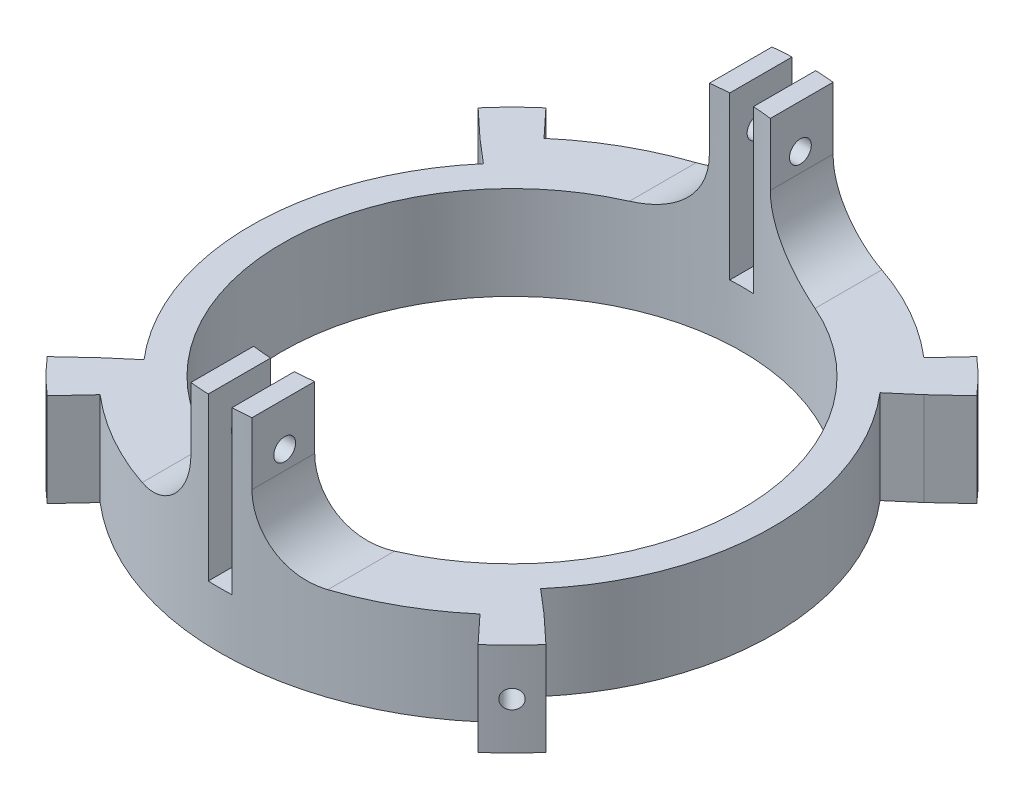
from build123d import *
from build123d.topology import SkipClean

# Parameters (mm, degrees)
SKETCH1_R           = 46.9
SKETCH1_R_2         = 36.9
BOSS_EXTRUDE1_DEPTH = 15
BOSS_EXTRUDE2_DEPTH = 20
SKETCH4_W           = 3.8
SKETCH4_H           = 13.672543204
CUT_EXTRUDE2_DEPTH  = 6
SKETCH5_R           = 1.75
CUT_EXTRUDE3_DEPTH  = 75.99479982
FILLET3_R           = 10
BOSS_EXTRUDE3_DEPTH = 15
SKETCH9_R           = 1.5
CUT_EXTRUDE4_DEPTH  = 15
CIRPATTERN1_COUNT   = 4
CUT_EXTRUDE5_DEPTH  = 15


with BuildPart() as part:
    # Sketch1 → Boss-Extrude1 (new body)
    with BuildSketch(Plane(origin=(0, 0, 0), x_dir=(1, 0, 0), z_dir=(0, 1, 0))):
        with Locations(Location((0, 0, 0), (0, 0, 270))):
            Circle(SKETCH1_R)
        with Locations(Location((0, 0, 0), (0, 0, 270))):
            Circle(SKETCH1_R_2, mode=Mode.SUBTRACT)
    extrude(amount=BOSS_EXTRUDE1_DEPTH)

    # Sketch7 → Boss-Extrude2 (add)
    with SkipClean():  # the faces are left unmerged after this step: merging them gives an invalid solid
        with BuildSketch(Plane(origin=(0, 15, 0), x_dir=(1, 0, 0), z_dir=(0, 1, 0))):
            with BuildLine():
                Line((-1.9, 46.861498055), (-1.9, 36.851051545))
                ThreePointArc((-1.9, 36.851051545), (-3.402836815, 36.742763935), (-4.9, 36.573214242))
                Line((-4.9, 36.573214242), (-4.9, 46.643327497))
                ThreePointArc((-4.9, 46.643327497), (-3.401749491, 46.776469516), (-1.9, 46.861498055))
            make_face()
            with BuildLine():
                Line((4.9, 46.643327497), (4.9, 36.573214242))
                ThreePointArc((4.9, 36.573214242), (3.402836815, 36.742763935), (1.9, 36.851051545))
                Line((1.9, 36.851051545), (1.9, 46.861498055))
                ThreePointArc((1.9, 46.861498055), (3.401749491, 46.776469516), (4.9, 46.643327497))
            make_face()
            with BuildLine():
                Line((1.9, -46.861498055), (1.9, -36.851051545))
                ThreePointArc((1.9, -36.851051545), (3.402836815, -36.742763935), (4.9, -36.573214242))
                Line((4.9, -36.573214242), (4.9, -46.643327497))
                ThreePointArc((4.9, -46.643327497), (3.401749491, -46.776469516), (1.9, -46.861498055))
            make_face()
            with BuildLine():
                Line((-4.9, -46.643327497), (-4.9, -36.573214242))
                ThreePointArc((-4.9, -36.573214242), (-3.402836815, -36.742763935), (-1.9, -36.851051545))
                Line((-1.9, -36.851051545), (-1.9, -46.861498055))
                ThreePointArc((-1.9, -46.861498055), (-3.401749491, -46.776469516), (-4.9, -46.643327497))
            make_face()
        extrude(amount=BOSS_EXTRUDE2_DEPTH)

    # Sketch4 → Cut-Extrude2 (cut)
    with SkipClean():  # the faces are left unmerged after this step: merging them gives an invalid solid
        with BuildSketch(Plane(origin=(0, 15, 0), x_dir=(1, 0, 0), z_dir=(0, 1, 0))):
            with Locations((0, 42.34115802)):
                Rectangle(SKETCH4_W, SKETCH4_H)
            with Locations((0, -42.34115802)):
                Rectangle(SKETCH4_W, SKETCH4_H)
        extrude(amount=-CUT_EXTRUDE2_DEPTH, mode=Mode.SUBTRACT)

    # Sketch5 → Cut-Extrude3 (cut, symmetric)
    with SkipClean():  # the faces are left unmerged after this step: merging them gives an invalid solid
        with BuildSketch(Plane(origin=(0, 0, 0), x_dir=(0, 0, -1), z_dir=(1, 0, 0))):
            with Locations((-41.4, 28)):
                Circle(SKETCH5_R)
        cut_extrude3 = extrude(amount=CUT_EXTRUDE3_DEPTH, both=True, mode=Mode.SUBTRACT)

    # Mirror1: Cut-Extrude3 across plane
    with SkipClean():  # the faces are left unmerged after this step: merging them gives an invalid solid
        add(cut_extrude3.mirror(Plane.XY), mode=Mode.SUBTRACT)

    # Fillet3
    # the kernel refuses this fillet: 10 mm, written as the material it adds along each edge
    with BuildSketch(Plane(origin=(-4.9, 15, -11.573214242), x_dir=(-1, 0, 0), z_dir=(0, 0, -1))) as fillet3_piece_1_section:
        with BuildLine():
            CenterArc((FILLET3_R, FILLET3_R), FILLET3_R, 180, 90)
            Line((0, FILLET3_R), (0, 0))
            Line((0, 0), (FILLET3_R, 0))
        make_face()
    fillet3_piece_1 = extrude(amount=60.070113255, mode=Mode.PRIVATE)
    fillet3_piece_1 = fillet3_piece_1 & Plane(origin=(0, 17.250849012, 0), x_dir=(0, 0, 1), z_dir=(0, -1, 0)) * Cylinder(46.9, 161, mode=Mode.PRIVATE)
    fillet3_piece_1 = fillet3_piece_1 - Plane(origin=(0, 17.250849012, 0), x_dir=(0, 0, 1), z_dir=(0, -1, 0)) * Cylinder(36.9, 161, mode=Mode.PRIVATE)
    with BuildSketch(Plane(origin=(4.9, 15, -71.643327497), x_dir=(1, 0, 0), z_dir=(0, 0, 1))) as fillet3_piece_2_section:
        with BuildLine():
            CenterArc((FILLET3_R, FILLET3_R), FILLET3_R, 180, 90)
            Line((0, FILLET3_R), (0, 0))
            Line((0, 0), (FILLET3_R, 0))
        make_face()
    fillet3_piece_2 = extrude(amount=60.070113255, mode=Mode.PRIVATE)
    fillet3_piece_2 = fillet3_piece_2 & Plane(origin=(0, 17.250856037, 0), x_dir=(0, 0, 1), z_dir=(0, -1, 0)) * Cylinder(46.9, 161, mode=Mode.PRIVATE)
    fillet3_piece_2 = fillet3_piece_2 - Plane(origin=(0, 17.250856037, 0), x_dir=(0, 0, 1), z_dir=(0, -1, 0)) * Cylinder(36.9, 161, mode=Mode.PRIVATE)
    with BuildSketch(Plane(origin=(4.9, 15, 11.573214242), x_dir=(1, 0, 0), z_dir=(0, 0, 1))) as fillet3_piece_3_section:
        with BuildLine():
            CenterArc((FILLET3_R, FILLET3_R), FILLET3_R, 180, 90)
            Line((0, FILLET3_R), (0, 0))
            Line((0, 0), (FILLET3_R, 0))
        make_face()
    fillet3_piece_3 = extrude(amount=60.070113255, mode=Mode.PRIVATE)
    fillet3_piece_3 = fillet3_piece_3 & Plane(origin=(0, 17.250849012, 0), x_dir=(0, 0, 1), z_dir=(0, -1, 0)) * Cylinder(46.9, 161, mode=Mode.PRIVATE)
    fillet3_piece_3 = fillet3_piece_3 - Plane(origin=(0, 17.250849012, 0), x_dir=(0, 0, 1), z_dir=(0, -1, 0)) * Cylinder(36.9, 161, mode=Mode.PRIVATE)
    with BuildSketch(Plane(origin=(-4.9, 15, 71.643327497), x_dir=(-1, 0, 0), z_dir=(0, 0, -1))) as fillet3_piece_4_section:
        with BuildLine():
            CenterArc((FILLET3_R, FILLET3_R), FILLET3_R, 180, 90)
            Line((0, FILLET3_R), (0, 0))
            Line((0, 0), (FILLET3_R, 0))
        make_face()
    fillet3_piece_4 = extrude(amount=60.070113255, mode=Mode.PRIVATE)
    fillet3_piece_4 = fillet3_piece_4 & Plane(origin=(0, 17.250856037, 0), x_dir=(0, 0, 1), z_dir=(0, -1, 0)) * Cylinder(46.9, 161, mode=Mode.PRIVATE)
    fillet3_piece_4 = fillet3_piece_4 - Plane(origin=(0, 17.250856037, 0), x_dir=(0, 0, 1), z_dir=(0, -1, 0)) * Cylinder(36.9, 161, mode=Mode.PRIVATE)
    add([fillet3_piece_1, fillet3_piece_2, fillet3_piece_3, fillet3_piece_4])

    # Sketch8 → Boss-Extrude3 (add)
    with BuildSketch(Plane.XZ):
        with BuildLine():
            ThreePointArc((-35.632580164, 30.494741036), (-33.163308038, 33.163308038), (-30.494741036, 35.632580164))
            Line((-30.494741036, 35.632580164), (-34.586430477, 40.027350984))
            ThreePointArc((-34.586430477, 40.027350984), (-37.405948725, 37.405948725), (-40.027350984, 34.586430477))
            Line((-40.027350984, 34.586430477), (-35.632580164, 30.494741036))
        make_face()
    boss_extrude3 = extrude(amount=-BOSS_EXTRUDE3_DEPTH)

    # Sketch9 → Cut-Extrude4 (cut)
    with BuildSketch(Plane(origin=(-37.405948725, 0, 37.405948725), x_dir=(0, -1, 0), z_dir=(-0.7071067811865488, 0, 0.7071067811865464))):
        with Locations(Location((-7.5, 0, 0), (0, 0, 90))):
            Circle(SKETCH9_R)
    cut_extrude4 = extrude(amount=-CUT_EXTRUDE4_DEPTH, mode=Mode.SUBTRACT)

    # CirPattern1: Boss-Extrude3, Cut-Extrude4 ×4 about axis
    cirpattern1_axis = Axis((0, 0, 0), (0, 1, 0))
    add([boss_extrude3.rotate(cirpattern1_axis, i * 360 / CIRPATTERN1_COUNT) for i in range(1, CIRPATTERN1_COUNT)])
    add([cut_extrude4.rotate(cirpattern1_axis, i * 360 / CIRPATTERN1_COUNT) for i in range(1, CIRPATTERN1_COUNT)], mode=Mode.SUBTRACT)

    # Sketch10 → Cut-Extrude5 (cut)
    with BuildSketch(Plane.XZ):
        with BuildLine():
            Line((-35.632580164, 30.494741036), (-31.833797631, 27.243702546))
            ThreePointArc((-31.833797631, 27.243702546), (-41.9, 0), (-31.833797631, -27.243702546))
            Line((-31.833797631, -27.243702546), (-35.632580164, -30.494741036))
            ThreePointArc((-35.632580164, -30.494741036), (-46.9, 0), (-35.632580164, 30.494741036))
        make_face()
        with BuildLine():
            Line((35.632580164, -30.494741036), (31.833797631, -27.243702546))
            ThreePointArc((31.833797631, -27.243702546), (41.9, 0), (31.833797631, 27.243702546))
            Line((31.833797631, 27.243702546), (35.632580164, 30.494741036))
            ThreePointArc((35.632580164, 30.494741036), (46.9, 0), (35.632580164, -30.494741036))
        make_face()
    extrude(amount=-CUT_EXTRUDE5_DEPTH, mode=Mode.SUBTRACT)


solid = part.part
